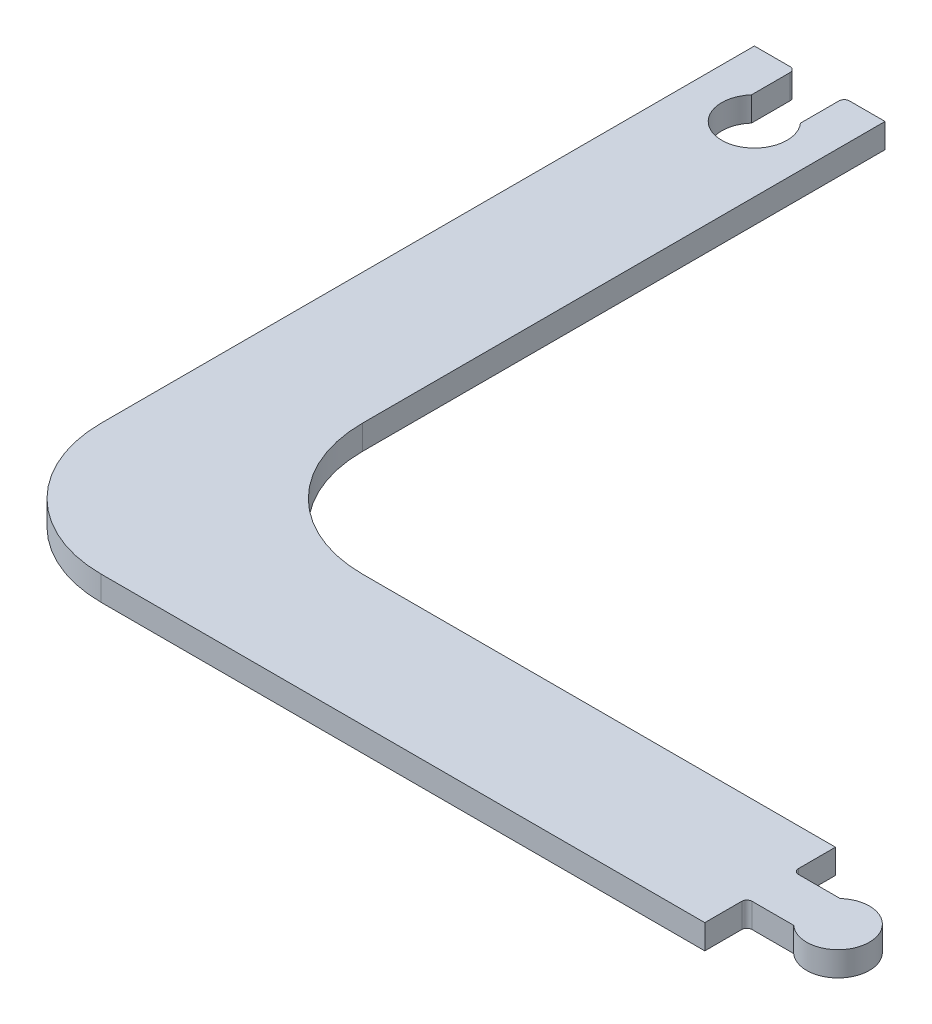
from build123d import *

# Parameters (mm, degrees)
BOSS_EXTRUDE1_DEPTH = 4.7625


with BuildPart() as part:
    # Sketch1 → Boss-Extrude1 (new body)
    with BuildSketch(Plane(origin=(0, 0, 0), x_dir=(1, 0, 0), z_dir=(0, 1, 0))):
        with BuildLine():
            Line((25.4, 0), (142.760516705, 0))
            Line((142.760516705, 0), (142.760516705, 7.1875))
            ThreePointArc((142.760516705, 7.1875), (143.053409924, 7.894606781), (143.760516705, 8.1875))
            Line((143.760516705, 8.1875), (151.855965115, 8.1875))
            ThreePointArc((151.855965115, 8.1875), (162.060516705, 12.7), (151.855965115, 17.2125))
            Line((151.855965115, 17.2125), (143.760516705, 17.2125))
            ThreePointArc((143.760516705, 17.2125), (143.053409924, 17.505393219), (142.760516705, 18.2125))
            Line((142.760516705, 18.2125), (142.760516705, 25.4))
            Line((142.760516705, 25.4), (50.8, 25.4))
            ThreePointArc((50.8, 25.4), (32.839487758, 32.839487758), (25.4, 50.8))
            Line((25.4, 50.8), (25.4, 152.4))
            Line((25.4, 152.4), (18.4625, 152.4))
            ThreePointArc((18.4625, 152.4), (17.755393219, 152.107106781), (17.4625, 151.4))
            Line((17.4625, 151.4), (17.4625, 143.900130206))
            ThreePointArc((17.4625, 143.900130206), (12.7, 133.35), (7.9375, 143.900130206))
            Line((7.9375, 143.900130206), (7.9375, 151.4))
            ThreePointArc((7.9375, 151.4), (7.644606781, 152.107106781), (6.9375, 152.4))
            Line((6.9375, 152.4), (0, 152.4))
            Line((0, 152.4), (0, 25.4))
            ThreePointArc((0, 25.4), (7.439487758, 7.439487758), (25.4, 0))
        make_face()
    extrude(amount=BOSS_EXTRUDE1_DEPTH)


solid = part.part
